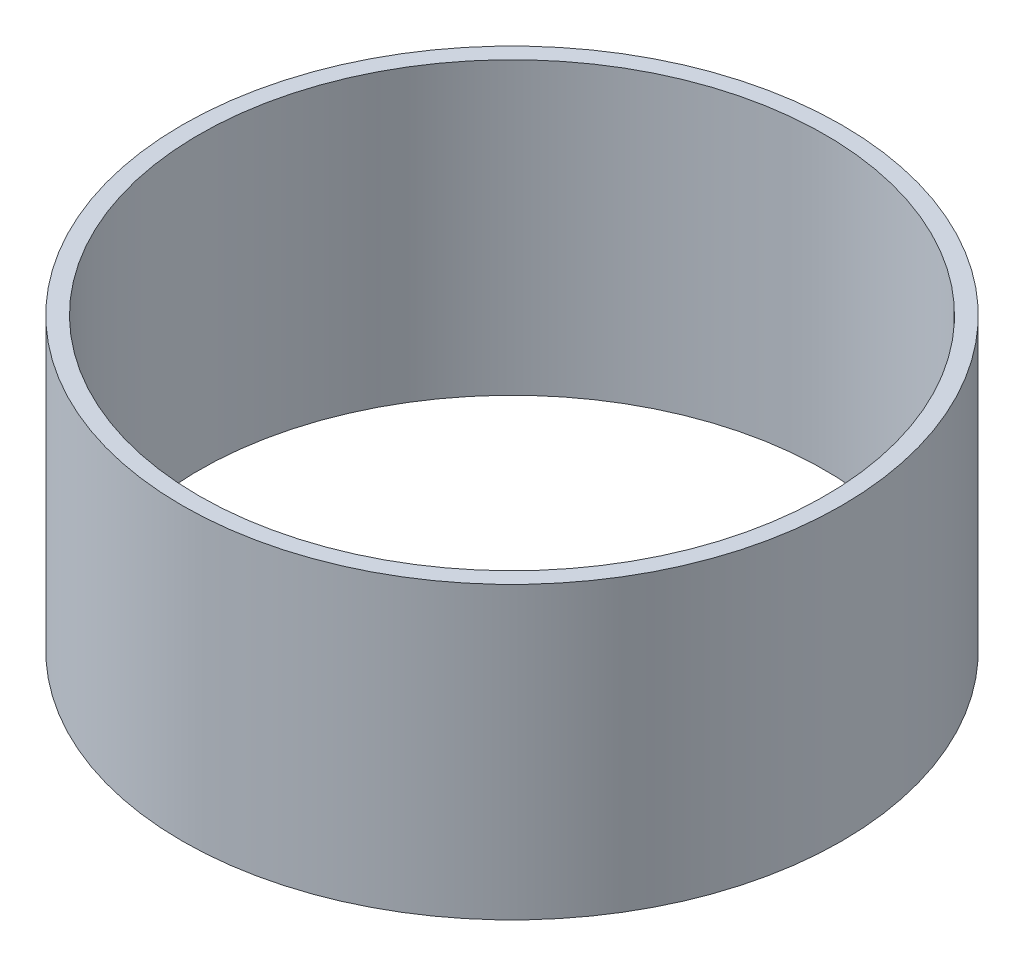
from build123d import *

# Parameters (mm, degrees)
SKETCH1_R           = 93.6625
SKETCH1_R_2         = 88.9
BOSS_EXTRUDE1_DEPTH = 41.275


with BuildPart() as part:
    # Sketch1 → Boss-Extrude1 (new, symmetric)
    with BuildSketch(Plane(origin=(0, 0, 0), x_dir=(1, 0, 0), z_dir=(0, 1, 0))):
        Circle(SKETCH1_R)
        Circle(SKETCH1_R_2, mode=Mode.SUBTRACT)
    extrude(amount=BOSS_EXTRUDE1_DEPTH, both=True)


solid = part.part
